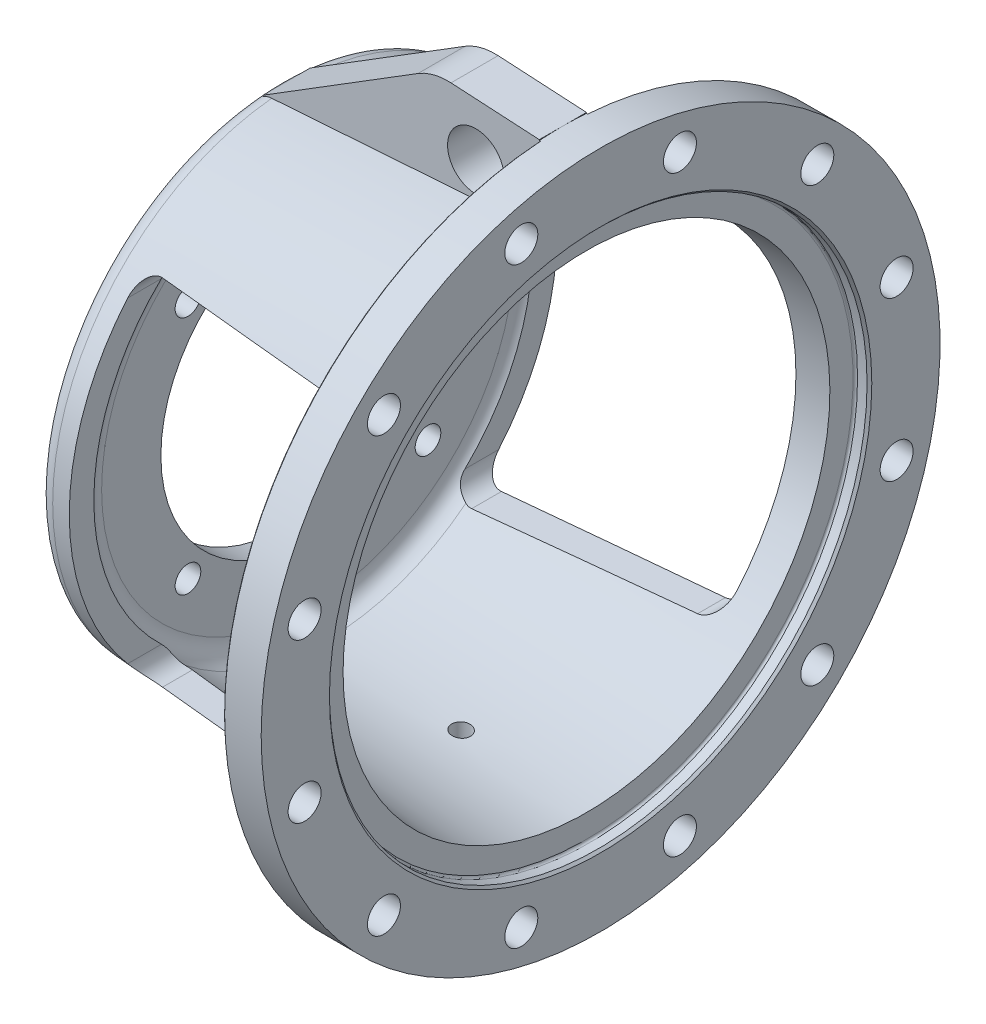
from build123d import *

# Parameters (mm, degrees)
SKETCH3_R               = 133.4135
CUT_EXTRUDE1_DEPTH      = 4.7752
CUT_EXTRUDE2_REACH      = 388.957
SKETCH4_R               = 99.06
SKETCH5_R               = 181.0385
CUT_EXTRUDE3_DEPTH      = 9.525
CUT_EXTRUDE4_REACH      = 388.957
SKETCH6_R               = 8.636
CIRPATTERN1_COUNT       = 4
CUT_EXTRUDE5_REACH      = 391.601
SKETCH7_R               = 11.1125
CIRPATTERN2_COUNT       = 12
BOSS_EXTRUDE1_DEPTH     = 15.875
CUT_EXTRUDE6_REACH      = 403.103
SKETCH9_R               = 19.05
CUT_EXTRUDE7_REACH      = 393.629
SKETCH10_R              = 6.35
CUT_EXTRUDE8_DEPTH      = 392.629265229
CUT_EXTRUDE8_DEPTH_BACK = 392.629265229
CHAMFER1_SIZE           = 1.5875
CHAMFER2_SIZE           = 0.79375
FILLET1_R               = 1.524


with BuildPart() as part:
    # Sketch2 → Revolve1 (revolve)
    with BuildSketch(Plane.XY):
        with BuildLine():
            Line((0, 0), (0, 150.729136562))
            ThreePointArc((0, 150.729136562), (3.411807989, 159.390515734), (11.814092783, 163.3982))
            Line((11.814092783, 163.3982), (180.209907217, 175.173582448))
            ThreePointArc((180.209907217, 175.173582448), (188.612192011, 179.181266713), (192.024, 187.842645886))
            Line((192.024, 187.842645886), (192.024, 228.6))
            Line((192.024, 228.6), (217.424, 228.6))
            Line((217.424, 228.6), (217.424, 180.975))
            Line((217.424, 180.975), (207.899, 180.975))
            Line((207.899, 180.975), (207.899, 163.926903472))
            Line((207.899, 163.926903472), (32.159492783, 151.638))
            ThreePointArc((32.159492783, 151.638), (23.757207989, 147.630315734), (20.3454, 138.968936562))
            Line((20.3454, 138.968936562), (20.3454, 0))
            Line((20.3454, 0), (0, 0))
        make_face()
    revolve(axis=Axis((0, 0, 0), (1, 0, 0)))

    # Sketch3 → Cut-Extrude1 (cut)
    with BuildSketch(Plane.ZY):
        Circle(SKETCH3_R)
    extrude(amount=-CUT_EXTRUDE1_DEPTH, mode=Mode.SUBTRACT)

    # Sketch4 → Cut-Extrude2 (cut, up to next)
    with BuildSketch(Plane.ZY.offset(-4.7752), mode=Mode.PRIVATE) as cut_extrude2_sk1:
        Circle(SKETCH4_R)
    cut_extrude2_tool1 = extrude(cut_extrude2_sk1.sketch, amount=-CUT_EXTRUDE2_REACH, mode=Mode.PRIVATE) & part.part
    add(cut_extrude2_tool1.solids().sort_by_distance((4.7752, 0, 0))[0], mode=Mode.SUBTRACT)

    # Sketch5 → Cut-Extrude3 (cut)
    with BuildSketch(Plane(origin=(217.424, 0, 0), x_dir=(0, 0, -1), z_dir=(1, 0, 0))):
        Circle(SKETCH5_R)
    extrude(amount=-CUT_EXTRUDE3_DEPTH, mode=Mode.SUBTRACT)

    # Sketch6 → Cut-Extrude4 (cut, up to next)
    with BuildSketch(Plane.ZY.offset(-4.7752), mode=Mode.PRIVATE) as cut_extrude4_sk1:
        with Locations((80.82230509, 80.82230509)):
            Circle(SKETCH6_R)
    cut_extrude4_tool1 = extrude(cut_extrude4_sk1.sketch, amount=-CUT_EXTRUDE4_REACH, mode=Mode.PRIVATE) & part.part
    cut_extrude4 = cut_extrude4_tool1.solids().sort_by_distance((4.7752, 80.822305, 80.822305))[0]
    add(cut_extrude4, mode=Mode.SUBTRACT)

    # CirPattern1: Cut-Extrude4 ×4 about axis
    cirpattern1_axis = Axis((4.7752, 0, 0), (-1, 0, 0))
    for i in range(1, CIRPATTERN1_COUNT):
        add(cut_extrude4.rotate(cirpattern1_axis, i * 360 / CIRPATTERN1_COUNT), mode=Mode.SUBTRACT)

    # Sketch7 → Cut-Extrude5 (cut, up to next)
    with BuildSketch(Plane(origin=(217.424, 0, 0), x_dir=(0, 0, -1), z_dir=(1, 0, 0)), mode=Mode.PRIVATE) as cut_extrude5_sk1:
        with Locations((199.3429424, 53.413780433)):
            Circle(SKETCH7_R)
    cut_extrude5_tool1 = extrude(cut_extrude5_sk1.sketch, amount=-CUT_EXTRUDE5_REACH, mode=Mode.PRIVATE) & part.part
    cut_extrude5 = cut_extrude5_tool1.solids().sort_by_distance((217.424, 53.41378, -199.342942))[0]
    add(cut_extrude5, mode=Mode.SUBTRACT)

    # CirPattern2: Cut-Extrude5 ×12 about axis
    cirpattern2_axis = Axis((217.424, 0, 0), (-1, 0, 0))
    for i in range(1, CIRPATTERN2_COUNT):
        add(cut_extrude5.rotate(cirpattern2_axis, i * 360 / CIRPATTERN2_COUNT), mode=Mode.SUBTRACT)

    # Sketch8 → Boss-Extrude1 (add, symmetric)
    with BuildSketch(Plane.XY):
        with BuildLine():
            Line((192.024, 173.460953796), (192.024, 228.6))
            Line((192.024, 228.6), (132.538836408, 231.9782))
            ThreePointArc((132.538836408, 231.9782), (120.967207489, 230.858806132), (110.271848346, 226.301950716))
            Line((110.271848346, 226.301950716), (5.987343994, 161.510149934))
            Line((5.987343994, 161.510149934), (5.448843156, 158.54562766))
            Line((5.448843156, 158.54562766), (192.024, 173.460953796))
        make_face()
    extrude(amount=BOSS_EXTRUDE1_DEPTH, both=True)

    # Sketch9 → Cut-Extrude6 (cut, up to next)
    with BuildSketch(Plane.XY.offset(15.875), mode=Mode.PRIVATE) as cut_extrude6_sk1:
        with Locations((149.2758, 194.564)):
            Circle(SKETCH9_R)
    cut_extrude6_tool1 = extrude(cut_extrude6_sk1.sketch, amount=-CUT_EXTRUDE6_REACH, mode=Mode.PRIVATE) & part.part
    add(cut_extrude6_tool1.solids().sort_by_distance((149.2758, 194.564, 15.875))[0], mode=Mode.SUBTRACT)

    # Sketch10 → Cut-Extrude7 (cut, up to next)
    with BuildSketch(Plane(origin=(0, 0, 0), x_dir=(1, 0, 0), z_dir=(0, 1, 0)), mode=Mode.PRIVATE) as cut_extrude7_sk1:
        with Locations((123.444, 0)):
            Circle(SKETCH10_R)
    cut_extrude7_tool1 = extrude(cut_extrude7_sk1.sketch, amount=-CUT_EXTRUDE7_REACH, mode=Mode.PRIVATE) & part.part
    add(cut_extrude7_tool1.solids().sort_by_distance((123.444, 0, 0))[0], mode=Mode.SUBTRACT)

    # Sketch11 → Cut-Extrude8 (cut, two sides: drawn at the far end of the back side and taken through both)
    with BuildSketch(Plane.XY.offset(-CUT_EXTRUDE8_DEPTH_BACK)):
        with BuildLine():
            Line((36.5252, -119.3419), (173.8376, -119.3419))
            ThreePointArc((173.8376, -119.3419), (182.817856121, -115.622156121), (186.5376, -106.6419))
            Line((186.5376, -106.6419), (186.5376, 106.6419))
            ThreePointArc((186.5376, 106.6419), (182.817856121, 115.622156121), (173.8376, 119.3419))
            Line((173.8376, 119.3419), (36.5252, 119.3419))
            ThreePointArc((36.5252, 119.3419), (27.544943879, 115.622156121), (23.8252, 106.6419))
            Line((23.8252, 106.6419), (23.8252, -106.6419))
            ThreePointArc((23.8252, -106.6419), (27.544943879, -115.622156121), (36.5252, -119.3419))
        make_face()
    extrude(amount=CUT_EXTRUDE8_DEPTH + CUT_EXTRUDE8_DEPTH_BACK, mode=Mode.SUBTRACT)

    # Chamfer1
    chamfer1_edges = [part.edges().sort_by_distance(p)[0] for p in [
        (217.424, 0, 181.0385),
    ]]
    chamfer(chamfer1_edges, length=CHAMFER1_SIZE)

    # Chamfer2
    chamfer2_edges = [part.edges().sort_by_distance(p)[0] for p in [
        (192.024, -228.6, 0),
    ]]
    chamfer(chamfer2_edges, length=CHAMFER2_SIZE)

    # Fillet1
    fillet1_edges = [part.edges().sort_by_distance(p)[0] for p in [
        (207.899, 0, 181.0385),
    ]]
    fillet(fillet1_edges, radius=FILLET1_R)


solid = part.part
